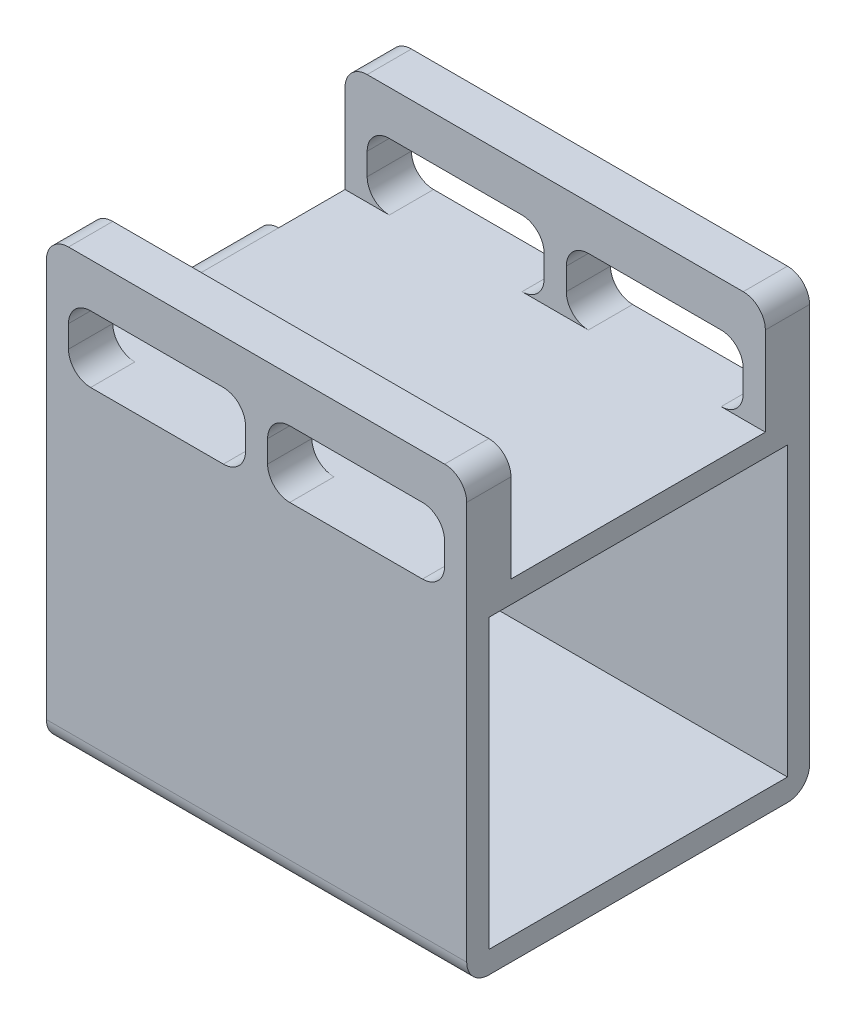
from build123d import *

# Parameters (mm, degrees)
SKETCH1_W           = 48.26
SKETCH1_H           = 34.29
BOSS_EXTRUDE1_DEPTH = 2.54
SKETCH2_W           = 2.54
SKETCH2_H           = 13.97
BOSS_EXTRUDE2_DEPTH = 38.1
SKETCH3_W           = 48.26
SKETCH3_H           = 2.54
BOSS_EXTRUDE3_DEPTH = 38.1
BOSS_EXTRUDE4_REACH = 73.673
SKETCH4_W           = 48.26
SKETCH4_H           = 2.54
FILLET3_R           = 2.54
SKETCH12_W          = 2.54
SKETCH12_H          = 5.08
BOSS_EXTRUDE8_DEPTH = 7.62
SKETCH13_W          = 48.26
SKETCH13_H          = 5.08
BOSS_EXTRUDE9_DEPTH = 5.08
FILLET6_R           = 2.54


with BuildPart() as part:
    # Sketch1 → Boss-Extrude1 (new body)
    with BuildSketch(Plane(origin=(0, 0, 0), x_dir=(1, 0, 0), z_dir=(0, 1, 0))):
        with Locations((24.13, 17.145)):
            Rectangle(SKETCH1_W, SKETCH1_H)
    extrude(amount=BOSS_EXTRUDE1_DEPTH)

    # Sketch2 → Boss-Extrude2 (add)
    with BuildSketch(Plane(origin=(0, 0, 0), x_dir=(1, 0, 0), z_dir=(0, 1, 0))):
        with Locations((-1.27, 17.145)):
            Rectangle(SKETCH2_W, SKETCH2_H)
    extrude(amount=BOSS_EXTRUDE2_DEPTH)

    # Sketch3 → Boss-Extrude3 (add)
    with BuildSketch(Plane(origin=(0, 0, 0), x_dir=(1, 0, 0), z_dir=(0, 1, 0))):
        with Locations((24.13, 35.56)):
            Rectangle(SKETCH3_W, SKETCH3_H)
        with Locations((24.13, -1.27)):
            Rectangle(SKETCH3_W, SKETCH3_H)
    extrude(amount=BOSS_EXTRUDE3_DEPTH)

    # Sketch4 → Boss-Extrude4 (add, up to next)
    with BuildSketch(Plane.XY.offset(-34.29), mode=Mode.PRIVATE) as boss_extrude4_sk1:
        with Locations((24.13, 36.83)):
            Rectangle(SKETCH4_W, SKETCH4_H)
    boss_extrude4_tool1 = extrude(boss_extrude4_sk1.sketch, amount=BOSS_EXTRUDE4_REACH, mode=Mode.PRIVATE) - part.part
    add(boss_extrude4_tool1.solids().sort_by_distance((24.13, 36.83, -34.29))[0])

    # Fillet3
    fillet3_edges = [part.edges().sort_by_distance(p)[0] for p in [
        (0, 2.54, -17.145),
        (0, 35.56, -17.145),
        (-2.54, 0, -17.145),
        (-2.54, 38.1, -17.145),
        (24.13, 0, 2.54),
        (24.13, 0, -36.83),
    ]]
    fillet(fillet3_edges, radius=FILLET3_R)

    # Sketch12 → Boss-Extrude8 (add)
    with BuildSketch(Plane(origin=(0, 38.1, 0), x_dir=(1, 0, 0), z_dir=(0, 1, 0))):
        with Locations((1.27, 0)):
            Rectangle(SKETCH12_W, SKETCH12_H)
        with Locations((46.99, 34.29)):
            Rectangle(SKETCH12_W, SKETCH12_H)
        with Locations((24.13, 0)):
            Rectangle(SKETCH12_W, SKETCH12_H)
        with Locations((46.99, 0)):
            Rectangle(SKETCH12_W, SKETCH12_H)
        with Locations((24.13, 34.29)):
            Rectangle(SKETCH12_W, SKETCH12_H)
        with Locations((1.27, 34.29)):
            Rectangle(SKETCH12_W, SKETCH12_H)
    extrude(amount=BOSS_EXTRUDE8_DEPTH)

    # Sketch13 → Boss-Extrude9 (add)
    with BuildSketch(Plane(origin=(0, 45.72, 0), x_dir=(1, 0, 0), z_dir=(0, 1, 0))):
        with Locations((24.13, 34.29)):
            Rectangle(SKETCH13_W, SKETCH13_H)
        with Locations((24.13, 0)):
            Rectangle(SKETCH13_W, SKETCH13_H)
    extrude(amount=BOSS_EXTRUDE9_DEPTH)

    # Fillet6
    fillet6_edges = [part.edges().sort_by_distance(p)[0] for p in [
        (2.54, 45.72, -34.29),
        (22.86, 45.72, -34.29),
        (45.72, 45.72, -34.29),
        (25.4, 45.72, -34.29),
        (25.4, 45.72, 0),
        (45.72, 45.72, 0),
        (22.86, 45.72, 0),
        (2.54, 45.72, 0),
        (2.54, 38.1, 0),
        (25.4, 38.1, 0),
        (25.4, 38.1, -34.29),
        (45.72, 38.1, 0),
        (22.86, 38.1, 0),
        (45.72, 38.1, -34.29),
        (22.86, 38.1, -34.29),
        (2.54, 38.1, -34.29),
        (48.26, 50.8, 0),
        (0, 50.8, 0),
        (0, 50.8, -34.29),
        (48.26, 50.8, -34.29),
    ]]
    fillet(fillet6_edges, radius=FILLET6_R)


solid = part.part
